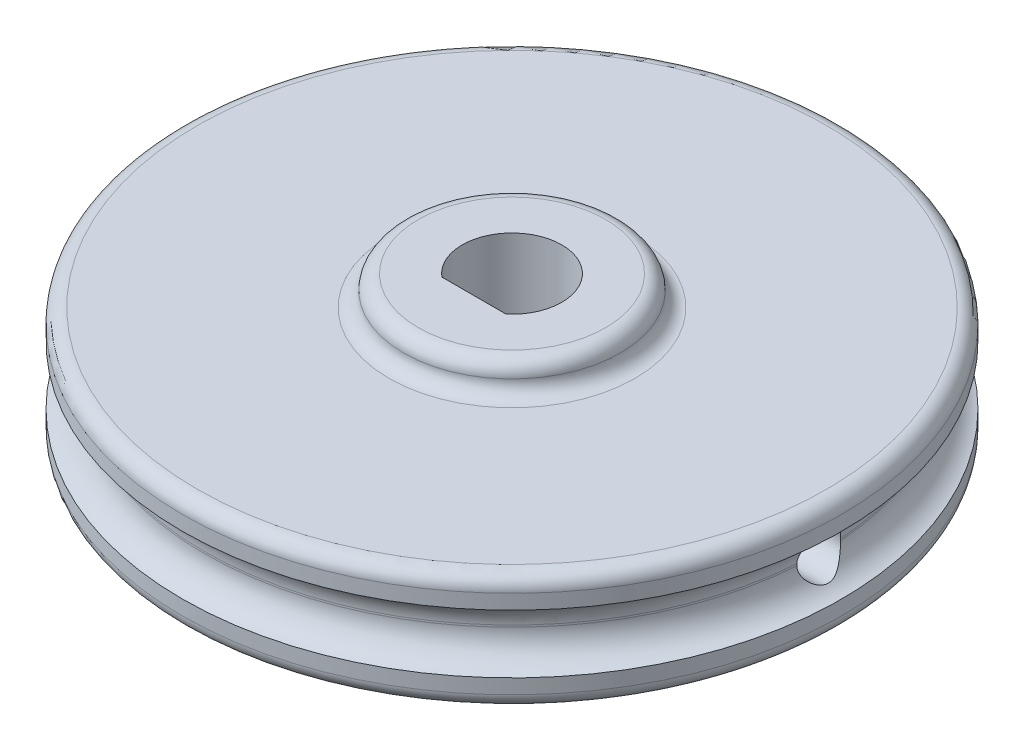
from build123d import *

# Parameters (mm, degrees)
SKETCH1_R            = 11.25
SKETCH1_R_2          = 1.7
BOSS_EXTRUDE1_DEPTH  = 4
SKETCH2_R            = 3.7
BOSS_EXTRUDE2_DEPTH  = 1
CUT_SWEEP1_PROFILE_R = 0.75
SKETCH21_R           = 12.5
SKETCH21_R_2         = 10.5
CUT_EXTRUDE1_DEPTH   = 1
FILLET1_R            = 1
FILLET2_R            = 0.5


# Some blends are built 0.0001 mm under size
with BuildPart() as part:
    # Sketch1 → Boss-Extrude1 (new body)
    # profile 1 of 5: a face of its own
    with BuildSketch(Plane(origin=(0, 0, 0), x_dir=(1, 0, 0), z_dir=(0, 1, 0))):
        with Locations(Location((0, 0, 0), (0, 0, 270))):
            Circle(SKETCH1_R)
        Circle(SKETCH1_R_2, mode=Mode.SUBTRACT)
    # profile 2 of 5: a face of its own
    with BuildSketch(Plane(origin=(0, 0, 0), x_dir=(1, 0, 0), z_dir=(0, 1, 0))):
        with BuildLine():
            Line((0, -1.3), (-1.095445115, -1.3))
            ThreePointArc((-1.095445115, -1.3), (-0.583095189, -1.596871942), (0, -1.7))
            Line((0, -1.7), (0, -1.3))
        make_face()
    # profile 3 of 5: a face of its own
    with BuildSketch(Plane(origin=(0, 0, 0), x_dir=(1, 0, 0), z_dir=(0, 1, 0))):
        with BuildLine():
            Line((1.095445115, -1.3), (0, -1.3))
            Line((0, -1.3), (0, -1.7))
            ThreePointArc((0, -1.7), (0.583095189, -1.596871942), (1.095445115, -1.3))
        make_face()
    # profile 4 of 5: a face of its own
    with BuildSketch(Plane(origin=(0, 0, 0), x_dir=(1, 0, 0), z_dir=(0, 1, 0))):
        with BuildLine():
            Line((0, -1.3), (-1.095445115, -1.3))
            ThreePointArc((-1.095445115, -1.3), (-0.583095189, -1.596871942), (0, -1.7))
            Line((0, -1.7), (0, -1.3))
        make_face()
    # profile 5 of 5: a face of its own
    with BuildSketch(Plane(origin=(0, 0, 0), x_dir=(1, 0, 0), z_dir=(0, 1, 0))):
        with BuildLine():
            Line((1.095445115, -1.3), (0, -1.3))
            Line((0, -1.3), (0, -1.7))
            ThreePointArc((0, -1.7), (0.583095189, -1.596871942), (1.095445115, -1.3))
        make_face()
    extrude(amount=BOSS_EXTRUDE1_DEPTH)

    # Sketch2 → Boss-Extrude2 (add)
    with BuildSketch(Plane(origin=(0, 4, 0), x_dir=(1, 0, 0), z_dir=(0, 1, 0))):
        with Locations(Location((0, 0, 0), (0, 0, 270))):
            Circle(SKETCH2_R)
        with BuildLine():
            Line((-1.095445115, -1.3), (1.095445115, -1.3))
            ThreePointArc((1.095445115, -1.3), (0, 1.7), (-1.095445115, -1.3))
        make_face(mode=Mode.SUBTRACT)
    extrude(amount=BOSS_EXTRUDE2_DEPTH)

    # Cut-Sweep1: sweep along a curve in space
    with BuildLine() as cut_sweep1_path:
        Line((12.5, 2, 0), (9.136774381, 2, 0))
        ThreePointArc((7.136774381, 0, 0), (7.722560819, 1.414213562, 0), (9.136774381, 2, 0))
        Line((7.136774381, 0, 0), (7.136774381, -2.281561943, 0))
    # Cut-Sweep1 profile (on start of the path) → Cut-Sweep1 (sweep, cut)
    with BuildSketch(Plane(origin=(12.5, 2, 0), x_dir=(0, -1, 0), z_dir=(-1, 0, 0))):
        Circle(CUT_SWEEP1_PROFILE_R)
    cut_sweep1 = sweep(path=cut_sweep1_path.line, mode=Mode.SUBTRACT)

    # Mirror1: Cut-Sweep1 across plane
    add(cut_sweep1.mirror(Plane(origin=(0, 0, 0), x_dir=(0, 0, 1), z_dir=(1, 0, 0))), mode=Mode.SUBTRACT)

    # Sketch21 → Cut-Extrude1 (cut, symmetric)
    with BuildSketch(Plane(origin=(0, 2, 0), x_dir=(1, 0, 0), z_dir=(0, 1, 0))):
        Circle(SKETCH21_R)
        with Locations(Location((0, 0, 0), (0, 0, 270))):
            Circle(SKETCH21_R_2, mode=Mode.SUBTRACT)
    extrude(amount=CUT_EXTRUDE1_DEPTH, both=True, mode=Mode.SUBTRACT)

    # Fillet1
    # the kernel refuses this fillet: 1 mm, written as the material it adds along each edge
    with BuildSketch(Plane(origin=(0, 1, 0), x_dir=(0, 0, 1), z_dir=(-1, 0, 0))) as fillet1_piece_1_section:
        with BuildLine():
            CenterArc((11.5, 0.968245837), FILLET1_R, 180, 75.522487814)
            Line((10.5, 0.968245837), (10.48, 0.968245837))
            Line((10.48, 0.968245837), (10.48, 0))
            Line((10.48, 0), (10.5, -0.02))
            ThreePointArc((10.5, -0.02), (10.875, -0.02), (11.245, -0.019364917))
            Line((11.245, -0.019364917), (11.25, 0))
        make_face()
    fillet1_piece_1 = revolve(axis=Axis((0, 1, 0), (0, 1, 0)), mode=Mode.PRIVATE)
    fillet1_piece_1 = fillet1_piece_1 - Plane(origin=(0, 2, 0), x_dir=(0, -1, 0), z_dir=(-1, 0, 0)) * Cylinder(0.75, 45, mode=Mode.PRIVATE)
    add(fillet1_piece_1)
    with BuildSketch(Plane(origin=(0, 3, 0), x_dir=(0, 0, 1), z_dir=(-1, 0, 0))) as fillet1_piece_2_section:
        with BuildLine():
            CenterArc((11.5, -0.968245837), FILLET1_R, 104.477512186, 75.522487814)
            Line((11.25, 0), (11.245, 0.019364917))
            ThreePointArc((11.245, 0.019364917), (10.875, 0.02), (10.5, 0.02))
            Line((10.5, 0.02), (10.48, 0))
            Line((10.48, 0), (10.48, -0.968245837))
            Line((10.48, -0.968245837), (10.5, -0.968245837))
        make_face()
    fillet1_piece_2 = revolve(axis=Axis((0, 3, 0), (0, 1, 0)), mode=Mode.PRIVATE)
    fillet1_piece_2 = fillet1_piece_2 - Plane(origin=(0, 2, 0), x_dir=(0, -1, 0), z_dir=(-1, 0, 0)) * Cylinder(0.75, 45, mode=Mode.PRIVATE)
    add(fillet1_piece_2)

    # Fillet2
    fillet2_edges = [part.edges().sort_by_distance(p)[0] for p in [
        (0, 5, -3.7),
        (0, 4, -3.7),
        (0, 4, -11.25),
        (0, 0, -11.25),
    ]]
    fillet(fillet2_edges, radius=FILLET2_R - 0.0001)  # a hair under: the kernel refuses the full size


solid = part.part
